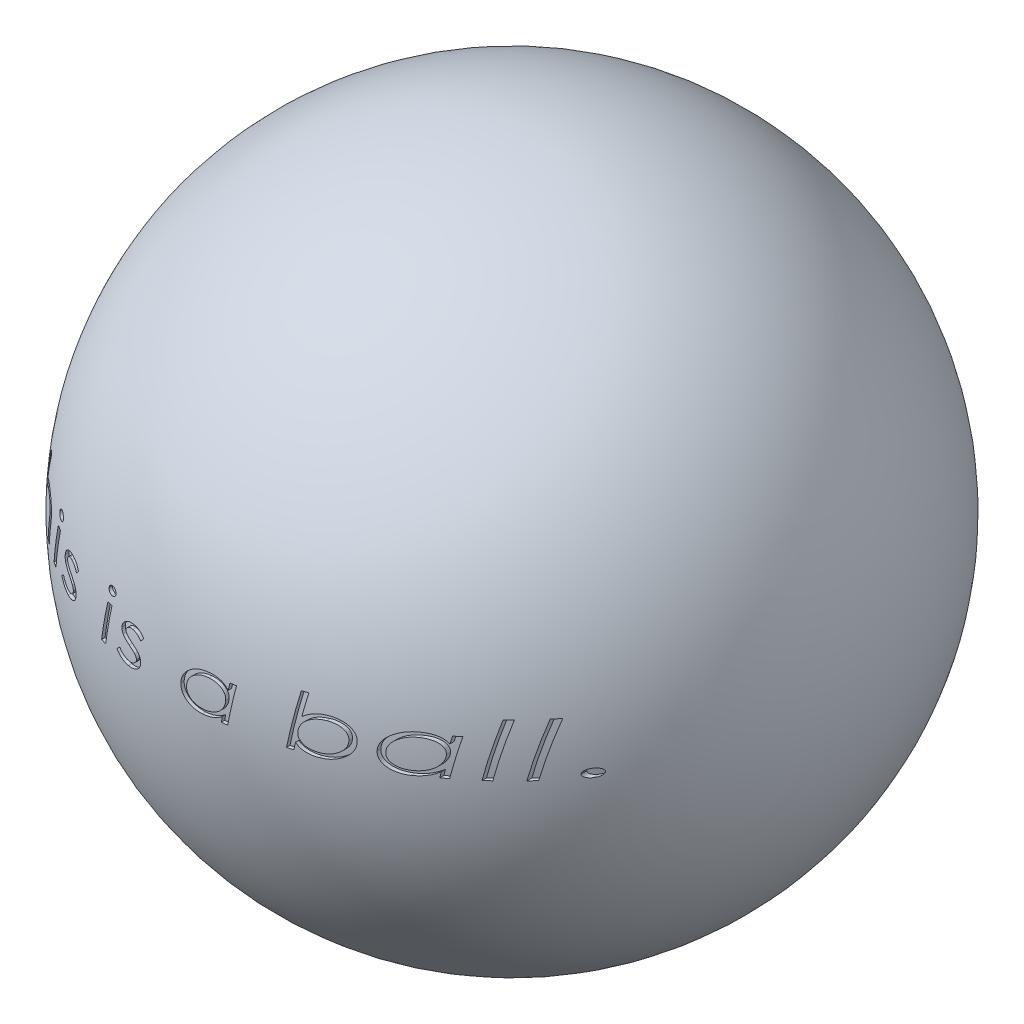
from build123d import *

# Parameters (mm, degrees)
CUT_EXTRUDE2_DEPTH = 40


with BuildPart() as part:
    # Sketch1 → Revolve1 (revolve)
    with BuildSketch(Plane.XY):
        with BuildLine():
            Line((0, 0), (100, 0))
            ThreePointArc((100, 0), (50, 50), (0, 0))
        make_face()
    revolve(axis=Axis((0, 0, 0), (1, 0, 0)))

    # Sketch2 → Cut-Extrude2 (cut)
    # profile 1 of 14: a face of its own
    with BuildSketch(Plane.XY.offset(50)):
        Polygon((6.972898638, 7.408333333), (12.549925214, 7.408333333), (12.428233841, 6.743482906), (10.156166867, 6.743482906), (9.044620059, 0), (8.085929487, 0), (9.197476295, 6.743482906), (6.851207265, 6.743482906), align=None)
    # profile 2 of 14: a face of its own
    with BuildSketch(Plane.XY.offset(50)):
        with BuildLine():
            Line((14.416255342, 7.598290598), (15.27848324, 7.598290598))
            Line((15.27848324, 7.598290598), (14.765005008, 4.496644631))
            add(Edge.make_bspline(
                [(14.765005008, 4.496644631), (14.860136595, 4.57749569), (15.04660089, 4.735969191), (15.344955149, 4.941255012), (15.648867908, 5.117681081), (15.961918837, 5.260965263), (16.283095614, 5.371588321), (16.611652305, 5.449760597), (16.948011631, 5.499325405), (17.174917112, 5.505597364), (17.289358974, 5.508760684)],
                knots=[0, 0, 0, 0, 1.076214626, 2.109452906, 3.118662003, 4.103837887, 5.073978004, 6.043639511, 7.01329163, 8, 8, 8, 8], degree=3))
            add(Edge.make_bspline(
                [(17.289358974, 5.508760684), (17.375496917, 5.507550728), (17.544159211, 5.505181576), (17.790983509, 5.480340389), (18.026328486, 5.44280498), (18.249001314, 5.387611265), (18.459869647, 5.318208737), (18.657676316, 5.231500091), (18.844492884, 5.13067143), (19.017042073, 5.013789796), (19.173925723, 4.885567275), (19.312401339, 4.747561803), (19.426771709, 4.597321891), (19.523407733, 4.440009452), (19.59611357, 4.271235652), (19.65020652, 4.094281378), (19.681757997, 3.907120157), (19.685610216, 3.77947496), (19.687569444, 3.714554955)],
                knots=[0, 0, 0, 0, 1.235015424, 2.418220465, 3.554284762, 4.650412109, 5.704900393, 6.734340054, 7.743931567, 8.745539027, 9.71846673, 10.64659281, 11.542036245, 12.420539361, 13.287884324, 14.169961337, 15.069247233, 16, 16, 16, 16], degree=3))
            add(Edge.make_bspline(
                [(19.687569444, 3.714554955), (19.687333752, 3.67645914), (19.686837613, 3.596266514), (19.680680862, 3.471035104), (19.669401188, 3.335088778), (19.657456686, 3.188875204), (19.63592404, 3.032474126), (19.617274414, 2.865286699), (19.588889748, 2.688045733), (19.569801091, 2.566404435), (19.559941907, 2.50357739)],
                knots=[0, 0, 0, 0, 0.750036975, 1.578846247, 2.467797257, 3.436025511, 4.466525469, 5.575551111, 6.747785821, 8, 8, 8, 8], degree=3))
            Line((19.559941907, 2.50357739), (19.141442308, 0))
            Line((19.141442308, 0), (18.27921441, 0))
            Line((18.27921441, 0), (18.697714009, 2.500609308))
            add(Edge.make_bspline(
                [(18.697714009, 2.500609308), (18.707993561, 2.561891792), (18.727937738, 2.680790815), (18.750552053, 2.854257126), (18.772101936, 3.016848585), (18.788915498, 3.168686556), (18.798542599, 3.310345129), (18.806597901, 3.440901498), (18.80995142, 3.561198059), (18.808314475, 3.637880328), (18.807533053, 3.674485844)],
                knots=[0, 0, 0, 0, 1.262966209, 2.450381239, 3.55540805, 4.596989276, 5.554828615, 6.441118602, 7.25584286, 8, 8, 8, 8], degree=3))
            add(Edge.make_bspline(
                [(18.807533053, 3.674485844), (18.806023477, 3.717107516), (18.803056172, 3.800887003), (18.782102351, 3.923683919), (18.746287963, 4.039730612), (18.696882231, 4.149692993), (18.632346537, 4.25290632), (18.552837668, 4.349353518), (18.460680355, 4.440354644), (18.354564474, 4.522991663), (18.237880225, 4.599018195), (18.109776151, 4.663243618), (17.974277192, 4.720356034), (17.829455354, 4.766905896), (17.675084009, 4.799709837), (17.512110187, 4.825022126), (17.340677655, 4.842246349), (17.223114632, 4.843348634), (17.163215478, 4.843910256)],
                knots=[0, 0, 0, 0, 0.907329905, 1.783497237, 2.643047196, 3.486836209, 4.34315355, 5.226508387, 6.14259909, 7.095024576, 8.085421458, 9.1028909, 10.141563833, 11.214128256, 12.335982046, 13.497910263, 14.725168395, 16, 16, 16, 16], degree=3))
            add(Edge.make_bspline(
                [(17.163215478, 4.843910256), (17.050241659, 4.840871843), (16.826677066, 4.834859107), (16.496073372, 4.783717145), (16.174646585, 4.702715758), (15.867227052, 4.588749796), (15.580351567, 4.450366565), (15.324539736, 4.28483684), (15.102125082, 4.097080471), (14.944144422, 3.918142817), (14.835776995, 3.755969871), (14.76098825, 3.61431117), (14.690040813, 3.453508705), (14.62327195, 3.273731412), (14.562914057, 3.07376448), (14.507134548, 2.854293137), (14.454677727, 2.615379571), (14.426425079, 2.448803288), (14.411803218, 2.362593483)],
                knots=[0, 0, 0, 0, 1.310456236, 2.593269982, 3.872881046, 5.151577425, 6.391686378, 7.562077559, 8.677948065, 9.760232801, 10.319112407, 10.938122858, 11.616622988, 12.357760014, 13.162249536, 14.039467798, 14.985347147, 16, 16, 16, 16], degree=3))
            Line((14.411803218, 2.362593483), (14.02001636, 0))
            Line((14.02001636, 0), (13.157788462, 0))
            Line((13.157788462, 0), (14.416255342, 7.598290598))
        make_face()
    # profile 3 of 14: a face of its own
    with BuildSketch(Plane.XY.offset(50)):
        with BuildLine():
            add(Edge.make_bspline(
                [(23.405982906, 7.693269231), (23.453144713, 7.691358901), (23.545098515, 7.687634234), (23.678121233, 7.655977364), (23.799510343, 7.601331642), (23.908654608, 7.529489925), (24.000474547, 7.44314744), (24.070029934, 7.345576554), (24.110379697, 7.236661137), (24.115664344, 7.161303929), (24.11832265, 7.123397436)],
                knots=[0, 0, 0, 0, 1.12083234, 2.185344453, 3.228309232, 4.272600601, 5.279636797, 6.209847376, 7.099510034, 8, 8, 8, 8], degree=3))
            add(Edge.make_bspline(
                [(24.11832265, 7.123397436), (24.115646807, 7.085010419), (24.110328726, 7.008718453), (24.070433206, 6.898599034), (24.000459214, 6.800634776), (23.908561207, 6.714575414), (23.80024214, 6.641776842), (23.677342607, 6.591637661), (23.545204397, 6.558915652), (23.453180609, 6.555352917), (23.405982906, 6.553525641)],
                knots=[0, 0, 0, 0, 0.91064925, 1.809862517, 2.73851646, 3.743867456, 4.786411282, 5.818312556, 6.881043288, 8, 8, 8, 8], degree=3))
            add(Edge.make_bspline(
                [(23.405982906, 6.553525641), (23.3577999, 6.555335297), (23.264311563, 6.558846529), (23.130594232, 6.591354419), (23.007288773, 6.641837207), (22.899206408, 6.714234474), (22.808115168, 6.80020616), (22.741960139, 6.899529551), (22.701481116, 7.008617479), (22.696266796, 7.08497662), (22.693643162, 7.123397436)],
                knots=[0, 0, 0, 0, 1.140503825, 2.212892386, 3.243091902, 4.28391642, 5.279146858, 6.193122213, 7.090852545, 8, 8, 8, 8], degree=3))
            add(Edge.make_bspline(
                [(22.693643162, 7.123397436), (22.696250184, 7.161337109), (22.70143288, 7.236760275), (22.742352308, 7.344652428), (22.808098768, 7.44357782), (22.899114402, 7.529828113), (23.008020149, 7.601271963), (23.129810806, 7.656272244), (23.264420349, 7.687696674), (23.357836899, 7.691373981), (23.405982906, 7.693269231)],
                knots=[0, 0, 0, 0, 0.89900244, 1.787195458, 2.702700314, 3.699596231, 4.742162527, 5.783404425, 6.857587587, 8, 8, 8, 8], degree=3))
        make_face()
    # profile 4 of 14: a face of its own
    with BuildSketch(Plane.XY.offset(50)):
        Polygon((22.747068643, 5.413782051), (23.610780582, 5.413782051), (22.701063368, 0), (21.83883547, 0), align=None)
    # profile 5 of 14: a face of its own
    with BuildSketch(Plane.XY.offset(50)):
        with BuildLine():
            Line((29.688819444, 4.75635183), (29.202053953, 4.187964076))
            add(Edge.make_bspline(
                [(29.202053953, 4.187964076), (29.149703697, 4.240593243), (29.047130645, 4.343712783), (28.877250834, 4.475975446), (28.701850995, 4.589032547), (28.51997341, 4.684525768), (28.32914951, 4.755238797), (28.131165247, 4.805807273), (27.926342182, 4.83812314), (27.786892831, 4.841969461), (27.716528779, 4.843910256)],
                knots=[0, 0, 0, 0, 1.065046905, 2.086811445, 3.083831041, 4.059181774, 5.030255031, 5.998518253, 6.990082334, 8, 8, 8, 8], degree=3))
            add(Edge.make_bspline(
                [(27.716528779, 4.843910256), (27.637701193, 4.840935225), (27.484345176, 4.835147415), (27.262974582, 4.793945849), (27.059672937, 4.722105577), (26.880510047, 4.623877008), (26.729124338, 4.511449508), (26.617889849, 4.387350221), (26.544366378, 4.254929754), (26.535238251, 4.161082628), (26.530779915, 4.11524606)],
                knots=[0, 0, 0, 0, 1.248232746, 2.428388461, 3.550988634, 4.648397772, 5.654460817, 6.520507429, 7.277390118, 8, 8, 8, 8], degree=3))
            add(Edge.make_bspline(
                [(26.530779915, 4.11524606), (26.533490096, 4.079764985), (26.538992554, 4.007728079), (26.581110702, 3.902446798), (26.647434772, 3.799898867), (26.708038949, 3.740155281), (26.740029714, 3.70861879)],
                knots=[0, 0, 0, 0, 0.903490396, 1.834348362, 2.856830367, 4, 4, 4, 4], degree=3))
            add(Edge.make_bspline(
                [(26.740029714, 3.70861879), (26.759611611, 3.691552637), (26.802394925, 3.654265822), (26.877317376, 3.598964307), (26.969741535, 3.542531903), (27.077117717, 3.479293839), (27.201770794, 3.413244671), (27.342545694, 3.342549457), (27.498683984, 3.265841675), (27.609500069, 3.216524941), (27.667555422, 3.190688435)],
                knots=[0, 0, 0, 0, 0.584763275, 1.277614275, 2.093492508, 3.02196788, 4.083436894, 5.269031656, 6.569275109, 8, 8, 8, 8], degree=3))
            add(Edge.make_bspline(
                [(27.667555422, 3.190688435), (27.752413394, 3.152169767), (27.915239298, 3.078259952), (28.145151503, 2.963056081), (28.354146863, 2.854272495), (28.538823201, 2.745984389), (28.701885709, 2.642403509), (28.841607199, 2.541385359), (28.960548711, 2.445009496), (29.026083663, 2.375627591), (29.056617922, 2.343300948)],
                knots=[0, 0, 0, 0, 1.366394551, 2.621844745, 3.770530423, 4.820569702, 5.760251889, 6.601830338, 7.348560241, 8, 8, 8, 8], degree=3))
            add(Edge.make_bspline(
                [(29.056617922, 2.343300948), (29.105996915, 2.280071087), (29.203277025, 2.15550379), (29.306857801, 1.942605486), (29.368001099, 1.713999845), (29.376047393, 1.556638368), (29.380138889, 1.476620927)],
                knots=[0, 0, 0, 0, 1.01675931, 2.003087742, 2.984581152, 4, 4, 4, 4], degree=3))
            add(Edge.make_bspline(
                [(29.380138889, 1.476620927), (29.378762055, 1.421065546), (29.376048988, 1.311593048), (29.344521927, 1.151782786), (29.297027176, 0.998699287), (29.230592246, 0.852115197), (29.140648028, 0.715281628), (29.035751551, 0.583527619), (28.908720519, 0.461744132), (28.766287831, 0.346660251), (28.607410281, 0.243279687), (28.436003255, 0.152564289), (28.253370805, 0.075276892), (28.058553494, 0.012956067), (27.852697561, -0.035996201), (27.635277259, -0.069297814), (27.406793026, -0.090746283), (27.250590348, -0.093542935), (27.170401643, -0.094978632)],
                knots=[0, 0, 0, 0, 0.882045941, 1.738081362, 2.578771594, 3.426822789, 4.286318992, 5.175522672, 6.098679517, 7.077535153, 8.083068511, 9.106796286, 10.156974707, 11.231343161, 12.354841379, 13.517164588, 14.725403694, 16, 16, 16, 16], degree=3))
            add(Edge.make_bspline(
                [(27.170401643, -0.094978632), (27.064376804, -0.092771993), (26.855375333, -0.088422154), (26.548936601, -0.043252793), (26.254839635, 0.025538381), (25.974265063, 0.12410471), (25.706735135, 0.251154646), (25.452741845, 0.406535968), (25.209177011, 0.587923073), (25.062104178, 0.729465264), (24.987377137, 0.801382212)],
                knots=[0, 0, 0, 0, 1.048294237, 2.066450101, 3.057676668, 4.032848047, 5.002674497, 5.98222065, 6.974775437, 8, 8, 8, 8], degree=3))
            Line((24.987377137, 0.801382212), (25.532020232, 1.305956197))
            add(Edge.make_bspline(
                [(25.532020232, 1.305956197), (25.598890575, 1.247468635), (25.730067066, 1.132736261), (25.938525204, 0.982579901), (26.151981632, 0.855276189), (26.369617258, 0.751468506), (26.591669114, 0.670141971), (26.817751494, 0.612055215), (27.04910007, 0.577020776), (27.20491094, 0.57226237), (27.283188769, 0.569871795)],
                knots=[0, 0, 0, 0, 1.095694798, 2.149374359, 3.164755529, 4.158534515, 5.120133565, 6.077947732, 7.034380094, 8, 8, 8, 8], degree=3))
            add(Edge.make_bspline(
                [(27.283188769, 0.569871795), (27.370494298, 0.573365955), (27.540690159, 0.58017757), (27.787341502, 0.63122335), (28.015767291, 0.718026485), (28.188741068, 0.818878078), (28.314189833, 0.911311654), (28.395435207, 0.985204521), (28.464837166, 1.061549323), (28.521546326, 1.13997163), (28.565888687, 1.221693969), (28.596469421, 1.306297308), (28.617408248, 1.393495116), (28.6193389, 1.452755094), (28.620309829, 1.482557091)],
                knots=[0, 0, 0, 0, 1.768851066, 3.448248125, 5.079541365, 6.701346398, 7.489471981, 8.234783124, 8.923442416, 9.577354201, 10.191953515, 10.801047985, 11.397043912, 12, 12, 12, 12], degree=3))
            add(Edge.make_bspline(
                [(28.620309829, 1.482557091), (28.616308885, 1.531546074), (28.60809172, 1.632159973), (28.547301141, 1.779052474), (28.449606795, 1.920830404), (28.363279763, 2.003957146), (28.317565438, 2.047976763)],
                knots=[0, 0, 0, 0, 0.889096953, 1.826033272, 2.848779816, 4, 4, 4, 4], degree=3))
            add(Edge.make_bspline(
                [(28.317565438, 2.047976763), (28.297994439, 2.063607774), (28.253324672, 2.099284729), (28.1722448, 2.151683417), (28.071573356, 2.212553707), (27.94925051, 2.279345931), (27.805043177, 2.351158753), (27.640696718, 2.431643886), (27.454709446, 2.517235236), (27.323789964, 2.576379863), (27.254991987, 2.60746027)],
                knots=[0, 0, 0, 0, 0.499217942, 1.139438444, 1.922738111, 2.845446788, 3.917485197, 5.135170685, 6.494536811, 8, 8, 8, 8], degree=3))
            add(Edge.make_bspline(
                [(27.254991987, 2.60746027), (27.180192048, 2.641858038), (27.036852802, 2.707774538), (26.832806501, 2.805991771), (26.651709277, 2.905019453), (26.490054481, 2.997935514), (26.347578719, 3.086161943), (26.228041605, 3.174070004), (26.126470225, 3.255978966), (26.071170614, 3.314768382), (26.045498464, 3.34206063)],
                knots=[0, 0, 0, 0, 1.388265562, 2.660335561, 3.817319581, 4.867440863, 5.804658646, 6.640521327, 7.368879085, 8, 8, 8, 8], degree=3))
            add(Edge.make_bspline(
                [(26.045498464, 3.34206063), (26.003304677, 3.393557331), (25.920615856, 3.494477436), (25.834802306, 3.66761666), (25.781279756, 3.850392029), (25.774428424, 3.975870269), (25.770950855, 4.039559963)],
                knots=[0, 0, 0, 0, 1.039747008, 2.037633, 3.003950378, 4, 4, 4, 4], degree=3))
            add(Edge.make_bspline(
                [(25.770950855, 4.039559963), (25.772483202, 4.089663571), (25.775512535, 4.188714612), (25.805110235, 4.333849156), (25.851665799, 4.473236312), (25.915085213, 4.607750737), (26.000387771, 4.734516246), (26.10147118, 4.857200741), (26.222841661, 4.972584585), (26.360381547, 5.081868797), (26.511843412, 5.181685202), (26.674547867, 5.26994753), (26.847500708, 5.344054522), (27.030031129, 5.405276886), (27.222566345, 5.450156844), (27.423570958, 5.485368739), (27.635057195, 5.503849104), (27.77932277, 5.507099384), (27.853060564, 5.508760684)],
                knots=[0, 0, 0, 0, 0.851110712, 1.682581483, 2.50721579, 3.34626884, 4.202518756, 5.098624722, 6.044554989, 7.044310791, 8.082538047, 9.125152126, 10.187732326, 11.2783777, 12.394420148, 13.546404715, 14.745905221, 16, 16, 16, 16], degree=3))
            add(Edge.make_bspline(
                [(27.853060564, 5.508760684), (27.939728304, 5.506869291), (28.109195603, 5.503170923), (28.357077631, 5.471183368), (28.592663621, 5.419528743), (28.818864959, 5.346166147), (29.040050417, 5.2464229), (29.258533421, 5.114246248), (29.477514132, 4.949820469), (29.616675035, 4.822406396), (29.688819444, 4.75635183)],
                knots=[0, 0, 0, 0, 1.019074265, 1.992664874, 2.934294439, 3.852476961, 4.784765789, 5.781654952, 6.849955774, 8, 8, 8, 8], degree=3))
        make_face()
    # profile 6 of 14: a face of its own
    with BuildSketch(Plane.XY.offset(50)):
        with BuildLine():
            add(Edge.make_bspline(
                [(37.196880342, 7.693269231), (37.244042149, 7.691358901), (37.33599595, 7.687634234), (37.469018669, 7.655977364), (37.590407779, 7.601331642), (37.699552043, 7.529489925), (37.791371983, 7.44314744), (37.86092737, 7.345576554), (37.901277133, 7.236661137), (37.90656178, 7.161303929), (37.909220085, 7.123397436)],
                knots=[0, 0, 0, 0, 1.12083234, 2.185344453, 3.228309232, 4.272600601, 5.279636797, 6.209847376, 7.099510034, 8, 8, 8, 8], degree=3))
            add(Edge.make_bspline(
                [(37.909220085, 7.123397436), (37.906544243, 7.085010419), (37.901226161, 7.008718453), (37.861330642, 6.898599034), (37.79135665, 6.800634776), (37.699458643, 6.714575414), (37.591139576, 6.641776842), (37.468240042, 6.591637661), (37.336101833, 6.558915652), (37.244078045, 6.555352917), (37.196880342, 6.553525641)],
                knots=[0, 0, 0, 0, 0.91064925, 1.809862517, 2.73851646, 3.743867456, 4.786411282, 5.818312556, 6.881043288, 8, 8, 8, 8], degree=3))
            add(Edge.make_bspline(
                [(37.196880342, 6.553525641), (37.148697336, 6.555335297), (37.055208999, 6.558846529), (36.921491668, 6.591354419), (36.798186209, 6.641837207), (36.690103844, 6.714234474), (36.599012604, 6.80020616), (36.532857575, 6.899529551), (36.492378552, 7.008617479), (36.487164232, 7.08497662), (36.484540598, 7.123397436)],
                knots=[0, 0, 0, 0, 1.140503825, 2.212892386, 3.243091902, 4.28391642, 5.279146858, 6.193122213, 7.090852545, 8, 8, 8, 8], degree=3))
            add(Edge.make_bspline(
                [(36.484540598, 7.123397436), (36.48714762, 7.161337109), (36.492330316, 7.236760275), (36.533249744, 7.344652428), (36.598996204, 7.44357782), (36.690011838, 7.529828113), (36.798917585, 7.601271963), (36.920708242, 7.656272244), (37.055317785, 7.687696674), (37.148734335, 7.691373981), (37.196880342, 7.693269231)],
                knots=[0, 0, 0, 0, 0.89900244, 1.787195458, 2.702700314, 3.699596231, 4.742162527, 5.783404425, 6.857587587, 8, 8, 8, 8], degree=3))
        make_face()
    # profile 7 of 14: a face of its own
    with BuildSketch(Plane.XY.offset(50)):
        Polygon((36.537966079, 5.413782051), (37.401678018, 5.413782051), (36.491960804, 0), (35.629732906, 0), align=None)
    # profile 8 of 14: a face of its own
    with BuildSketch(Plane.XY.offset(50)):
        with BuildLine():
            Line((43.47971688, 4.75635183), (42.992951389, 4.187964076))
            add(Edge.make_bspline(
                [(42.992951389, 4.187964076), (42.940601133, 4.240593243), (42.83802808, 4.343712783), (42.668148269, 4.475975446), (42.492748431, 4.589032547), (42.310870845, 4.684525768), (42.120046946, 4.755238797), (41.922062683, 4.805807273), (41.717239618, 4.83812314), (41.577790266, 4.841969461), (41.507426215, 4.843910256)],
                knots=[0, 0, 0, 0, 1.065046905, 2.086811445, 3.083831041, 4.059181774, 5.030255031, 5.998518253, 6.990082334, 8, 8, 8, 8], degree=3))
            add(Edge.make_bspline(
                [(41.507426215, 4.843910256), (41.428598629, 4.840935225), (41.275242612, 4.835147415), (41.053872018, 4.793945849), (40.850570373, 4.722105577), (40.671407483, 4.623877008), (40.520021774, 4.511449508), (40.408787285, 4.387350221), (40.335263814, 4.254929754), (40.326135686, 4.161082628), (40.32167735, 4.11524606)],
                knots=[0, 0, 0, 0, 1.248232746, 2.428388461, 3.550988634, 4.648397772, 5.654460817, 6.520507429, 7.277390118, 8, 8, 8, 8], degree=3))
            add(Edge.make_bspline(
                [(40.32167735, 4.11524606), (40.324387532, 4.079764985), (40.32988999, 4.007728079), (40.372008138, 3.902446798), (40.438332208, 3.799898867), (40.498936384, 3.740155281), (40.53092715, 3.70861879)],
                knots=[0, 0, 0, 0, 0.903490396, 1.834348362, 2.856830367, 4, 4, 4, 4], degree=3))
            add(Edge.make_bspline(
                [(40.53092715, 3.70861879), (40.550509047, 3.691552637), (40.593292361, 3.654265822), (40.668214812, 3.598964307), (40.760638971, 3.542531903), (40.868015153, 3.479293839), (40.99266823, 3.413244671), (41.13344313, 3.342549457), (41.28958142, 3.265841675), (41.400397505, 3.216524941), (41.458452858, 3.190688435)],
                knots=[0, 0, 0, 0, 0.584763275, 1.277614275, 2.093492508, 3.02196788, 4.083436894, 5.269031656, 6.569275109, 8, 8, 8, 8], degree=3))
            add(Edge.make_bspline(
                [(41.458452858, 3.190688435), (41.54331083, 3.152169767), (41.706136733, 3.078259952), (41.936048939, 2.963056081), (42.145044299, 2.854272495), (42.329720637, 2.745984389), (42.492783145, 2.642403509), (42.632504635, 2.541385359), (42.751446146, 2.445009496), (42.816981099, 2.375627591), (42.847515358, 2.343300948)],
                knots=[0, 0, 0, 0, 1.366394551, 2.621844745, 3.770530423, 4.820569702, 5.760251889, 6.601830338, 7.348560241, 8, 8, 8, 8], degree=3))
            add(Edge.make_bspline(
                [(42.847515358, 2.343300948), (42.896894351, 2.280071087), (42.99417446, 2.15550379), (43.097755237, 1.942605486), (43.158898535, 1.713999845), (43.166944829, 1.556638368), (43.171036325, 1.476620927)],
                knots=[0, 0, 0, 0, 1.01675931, 2.003087742, 2.984581152, 4, 4, 4, 4], degree=3))
            add(Edge.make_bspline(
                [(43.171036325, 1.476620927), (43.169659491, 1.421065546), (43.166946424, 1.311593048), (43.135419363, 1.151782786), (43.087924612, 0.998699287), (43.021489682, 0.852115197), (42.931545464, 0.715281628), (42.826648987, 0.583527619), (42.699617955, 0.461744132), (42.557185267, 0.346660251), (42.398307717, 0.243279687), (42.22690069, 0.152564289), (42.044268241, 0.075276892), (41.84945093, 0.012956067), (41.643594997, -0.035996201), (41.426174695, -0.069297814), (41.197690462, -0.090746283), (41.041487784, -0.093542935), (40.961299079, -0.094978632)],
                knots=[0, 0, 0, 0, 0.882045941, 1.738081362, 2.578771594, 3.426822789, 4.286318992, 5.175522672, 6.098679517, 7.077535153, 8.083068511, 9.106796286, 10.156974707, 11.231343161, 12.354841379, 13.517164588, 14.725403694, 16, 16, 16, 16], degree=3))
            add(Edge.make_bspline(
                [(40.961299079, -0.094978632), (40.85527424, -0.092771993), (40.646272769, -0.088422154), (40.339834037, -0.043252793), (40.045737071, 0.025538381), (39.765162499, 0.12410471), (39.497632571, 0.251154646), (39.243639281, 0.406535968), (39.000074447, 0.587923073), (38.853001614, 0.729465264), (38.778274573, 0.801382212)],
                knots=[0, 0, 0, 0, 1.048294237, 2.066450101, 3.057676668, 4.032848047, 5.002674497, 5.98222065, 6.974775437, 8, 8, 8, 8], degree=3))
            Line((38.778274573, 0.801382212), (39.322917668, 1.305956197))
            add(Edge.make_bspline(
                [(39.322917668, 1.305956197), (39.389788011, 1.247468635), (39.520964502, 1.132736261), (39.72942264, 0.982579901), (39.942879068, 0.855276189), (40.160514694, 0.751468506), (40.38256655, 0.670141971), (40.60864893, 0.612055215), (40.839997506, 0.577020776), (40.995808376, 0.57226237), (41.074086205, 0.569871795)],
                knots=[0, 0, 0, 0, 1.095694798, 2.149374359, 3.164755529, 4.158534515, 5.120133565, 6.077947732, 7.034380094, 8, 8, 8, 8], degree=3))
            add(Edge.make_bspline(
                [(41.074086205, 0.569871795), (41.161391734, 0.573365955), (41.331587595, 0.58017757), (41.578238938, 0.63122335), (41.806664727, 0.718026485), (41.979638504, 0.818878078), (42.105087269, 0.911311654), (42.186332643, 0.985204521), (42.255734602, 1.061549323), (42.312443762, 1.13997163), (42.356786123, 1.221693969), (42.387366856, 1.306297308), (42.408305684, 1.393495116), (42.410236335, 1.452755094), (42.411207265, 1.482557091)],
                knots=[0, 0, 0, 0, 1.768851066, 3.448248125, 5.079541365, 6.701346398, 7.489471981, 8.234783124, 8.923442416, 9.577354201, 10.191953515, 10.801047985, 11.397043912, 12, 12, 12, 12], degree=3))
            add(Edge.make_bspline(
                [(42.411207265, 1.482557091), (42.407206321, 1.531546074), (42.398989156, 1.632159973), (42.338198577, 1.779052474), (42.240504231, 1.920830404), (42.154177199, 2.003957146), (42.108462874, 2.047976763)],
                knots=[0, 0, 0, 0, 0.889096953, 1.826033272, 2.848779816, 4, 4, 4, 4], degree=3))
            add(Edge.make_bspline(
                [(42.108462874, 2.047976763), (42.088891875, 2.063607774), (42.044222108, 2.099284729), (41.963142236, 2.151683417), (41.862470792, 2.212553707), (41.740147946, 2.279345931), (41.595940613, 2.351158753), (41.431594154, 2.431643886), (41.245606882, 2.517235236), (41.1146874, 2.576379863), (41.045889423, 2.60746027)],
                knots=[0, 0, 0, 0, 0.499217942, 1.139438444, 1.922738111, 2.845446788, 3.917485197, 5.135170685, 6.494536811, 8, 8, 8, 8], degree=3))
            add(Edge.make_bspline(
                [(41.045889423, 2.60746027), (40.971089484, 2.641858038), (40.827750238, 2.707774538), (40.623703936, 2.805991771), (40.442606713, 2.905019453), (40.280951917, 2.997935514), (40.138476155, 3.086161943), (40.018939041, 3.174070004), (39.917367661, 3.255978966), (39.86206805, 3.314768382), (39.8363959, 3.34206063)],
                knots=[0, 0, 0, 0, 1.388265562, 2.660335561, 3.817319581, 4.867440863, 5.804658646, 6.640521327, 7.368879085, 8, 8, 8, 8], degree=3))
            add(Edge.make_bspline(
                [(39.8363959, 3.34206063), (39.794202112, 3.393557331), (39.711513292, 3.494477436), (39.625699742, 3.66761666), (39.572177192, 3.850392029), (39.56532586, 3.975870269), (39.561848291, 4.039559963)],
                knots=[0, 0, 0, 0, 1.039747008, 2.037633, 3.003950378, 4, 4, 4, 4], degree=3))
            add(Edge.make_bspline(
                [(39.561848291, 4.039559963), (39.563380637, 4.089663571), (39.566409971, 4.188714612), (39.59600767, 4.333849156), (39.642563235, 4.473236312), (39.705982648, 4.607750737), (39.791285207, 4.734516246), (39.892368616, 4.857200741), (40.013739097, 4.972584585), (40.151278983, 5.081868797), (40.302740848, 5.181685202), (40.465445303, 5.26994753), (40.638398144, 5.344054522), (40.820928565, 5.405276886), (41.013463781, 5.450156844), (41.214468394, 5.485368739), (41.425954631, 5.503849104), (41.570220206, 5.507099384), (41.643957999, 5.508760684)],
                knots=[0, 0, 0, 0, 0.851110712, 1.682581483, 2.50721579, 3.34626884, 4.202518756, 5.098624722, 6.044554989, 7.044310791, 8.082538047, 9.125152126, 10.187732326, 11.2783777, 12.394420148, 13.546404715, 14.745905221, 16, 16, 16, 16], degree=3))
            add(Edge.make_bspline(
                [(41.643957999, 5.508760684), (41.73062574, 5.506869291), (41.900093038, 5.503170923), (42.147975067, 5.471183368), (42.383561057, 5.419528743), (42.609762395, 5.346166147), (42.830947853, 5.2464229), (43.049430857, 5.114246248), (43.268411568, 4.949820469), (43.407572471, 4.822406396), (43.47971688, 4.75635183)],
                knots=[0, 0, 0, 0, 1.019074265, 1.992664874, 2.934294439, 3.852476961, 4.784765789, 5.781654952, 6.849955774, 8, 8, 8, 8], degree=3))
        make_face()
    # profile 9 of 14: a face of its own
    with BuildSketch(Plane.XY.offset(50)):
        with BuildLine():
            Line((56.449049145, 0), (55.586821247, 0))
            Line((55.586821247, 0), (55.723353032, 0.811770499))
            add(Edge.make_bspline(
                [(55.723353032, 0.811770499), (55.622595508, 0.739300437), (55.422809707, 0.595604077), (55.104535229, 0.411658253), (54.775648389, 0.254918864), (54.434930972, 0.127247547), (54.083049552, 0.027357826), (53.719806025, -0.044054345), (53.344429159, -0.085904489), (53.090273249, -0.091927962), (52.961552484, -0.094978632)],
                knots=[0, 0, 0, 0, 1.005956846, 1.994648997, 2.976161732, 3.957436708, 4.941560997, 5.939124516, 6.956241194, 8, 8, 8, 8], degree=3))
            add(Edge.make_bspline(
                [(52.961552484, -0.094978632), (52.845690978, -0.093398228), (52.618386042, -0.090297684), (52.285974226, -0.053780643), (51.967882663, -0.002577453), (51.666575332, 0.075757023), (51.379619153, 0.172425106), (51.111084371, 0.295683362), (50.855976606, 0.436414517), (50.620882524, 0.600765949), (50.405450721, 0.779773069), (50.218969522, 0.975544965), (50.059772642, 1.183002835), (49.929690404, 1.403581191), (49.829660121, 1.637196527), (49.758192606, 1.882803818), (49.713976411, 2.141366012), (49.708405249, 2.318389364), (49.705566239, 2.408598758)],
                knots=[0, 0, 0, 0, 1.211617855, 2.37703383, 3.495058042, 4.579614406, 5.630389009, 6.658811687, 7.666713829, 8.674562817, 9.655310361, 10.592440252, 11.49715346, 12.38567456, 13.264373761, 14.148770229, 15.056631148, 16, 16, 16, 16], degree=3))
            add(Edge.make_bspline(
                [(49.705566239, 2.408598758), (49.709442377, 2.513206899), (49.717101954, 2.719921432), (49.773127658, 3.024013432), (49.867740277, 3.315985865), (49.999873495, 3.596799587), (50.168112056, 3.867218076), (50.377576697, 4.122733516), (50.621063997, 4.369177731), (50.898982978, 4.600390055), (51.202360224, 4.811011378), (51.520053952, 5.000857861), (51.854511446, 5.155034923), (52.199902527, 5.286553069), (52.560198011, 5.384166848), (52.932273195, 5.458562173), (53.31828516, 5.499555743), (53.579813999, 5.505662809), (53.712477297, 5.508760684)],
                knots=[0, 0, 0, 0, 0.896607111, 1.771771485, 2.640913258, 3.521303397, 4.426297662, 5.364234586, 6.347937416, 7.39274828, 8.45875346, 9.512026621, 10.561270056, 11.612158048, 12.677158713, 13.75765355, 14.862545802, 16, 16, 16, 16], degree=3))
            add(Edge.make_bspline(
                [(53.712477297, 5.508760684), (53.854091958, 5.505763763), (54.129311916, 5.499939419), (54.528562752, 5.451034271), (54.900703172, 5.367578801), (55.192321865, 5.271547493), (55.409384923, 5.175420252), (55.564578568, 5.096902676), (55.710069608, 5.005590655), (55.850966045, 4.90860086), (55.980868105, 4.799076842), (56.105824364, 4.682723371), (56.222270192, 4.556047828), (56.293329675, 4.464983898), (56.328841814, 4.419474493)],
                knots=[0, 0, 0, 0, 1.731144421, 3.364379746, 4.908069982, 6.388502758, 7.108881604, 7.809513936, 8.512856251, 9.207563135, 9.899129577, 10.588045924, 11.294372751, 12, 12, 12, 12], degree=3))
            Line((56.328841814, 4.419474493), (56.498022503, 5.413782051))
            Line((56.498022503, 5.413782051), (57.35876636, 5.413782051))
            Line((57.35876636, 5.413782051), (56.449049145, 0))
        make_face()
        with BuildLine():
            add(Edge.make_bspline(
                [(53.006073718, 0.569871795), (53.076837748, 0.570616), (53.217042478, 0.572090493), (53.424623884, 0.587204764), (53.627095071, 0.612720533), (53.82469201, 0.646851051), (54.018086938, 0.689539594), (54.206876019, 0.743069028), (54.390550186, 0.806900046), (54.568839256, 0.879799452), (54.740472705, 0.960265531), (54.903025252, 1.051935162), (55.057486064, 1.150419845), (55.201460517, 1.259626095), (55.337278865, 1.375522707), (55.463911771, 1.499965235), (55.579189407, 1.634830614), (55.687841605, 1.774411473), (55.783974014, 1.921646907), (55.868772472, 2.072643467), (55.940419243, 2.227410471), (55.998096563, 2.385477471), (56.044766554, 2.545950752), (56.077192781, 2.709792707), (56.097318509, 2.877046931), (56.099299106, 2.989790962), (56.100299479, 3.046736445)],
                knots=[0, 0, 0, 0, 1.154537815, 2.287485061, 3.393808656, 4.483307877, 5.55844937, 6.623972713, 7.683363496, 8.729634383, 9.765893477, 10.774139951, 11.772743814, 12.752675614, 13.720127532, 14.684746694, 15.64608431, 16.613165745, 17.569134047, 18.512305441, 19.436883307, 20.348580994, 21.255549629, 22.161044364, 23.071168431, 24, 24, 24, 24], degree=3))
            add(Edge.make_bspline(
                [(56.100299479, 3.046736445), (56.098565102, 3.111703387), (56.095152743, 3.239524814), (56.060382815, 3.425957457), (56.009751775, 3.604083352), (55.934227923, 3.772101082), (55.836785746, 3.930149512), (55.718491692, 4.079301139), (55.579806187, 4.219332594), (55.420535304, 4.347834094), (55.245239922, 4.464265401), (55.05522124, 4.565678819), (54.852899587, 4.651382942), (54.637828886, 4.723496116), (54.409731871, 4.777573945), (54.169101344, 4.815675954), (53.916305849, 4.840332854), (53.74320714, 4.842699034), (53.654599693, 4.843910256)],
                knots=[0, 0, 0, 0, 0.918777795, 1.807680742, 2.676406941, 3.53542386, 4.406264815, 5.298802246, 6.224891562, 7.190725533, 8.191085784, 9.200014536, 10.235502688, 11.298571293, 12.407815344, 13.550000159, 14.74587031, 16, 16, 16, 16], degree=3))
            add(Edge.make_bspline(
                [(53.654599693, 4.843910256), (53.55013428, 4.842081438), (53.344139366, 4.8384752), (53.040961712, 4.804948624), (52.749020184, 4.75060004), (52.469293698, 4.672837715), (52.200775578, 4.575195611), (51.944266349, 4.45399448), (51.698711973, 4.311406252), (51.468141234, 4.14804871), (51.256564497, 3.969842446), (51.070198819, 3.780278502), (50.912016701, 3.57971568), (50.784002251, 3.368110383), (50.683625913, 3.146975654), (50.61119615, 2.915954377), (50.569512803, 2.674266552), (50.563443908, 2.509669413), (50.560373932, 2.426407252)],
                knots=[0, 0, 0, 0, 1.150975666, 2.269604147, 3.357042148, 4.420476637, 5.465699609, 6.502198733, 7.542933271, 8.591194565, 9.612455004, 10.587850796, 11.51596519, 12.421039903, 13.306745122, 14.18616944, 15.082466103, 16, 16, 16, 16], degree=3))
            add(Edge.make_bspline(
                [(50.560373932, 2.426407252), (50.562072506, 2.35847071), (50.565403653, 2.225237418), (50.600434736, 2.031016087), (50.65041798, 1.845055782), (50.728140941, 1.671204088), (50.823052382, 1.505809258), (50.941731583, 1.352501653), (51.081218665, 1.209404584), (51.23955048, 1.076344571), (51.414952013, 0.956727425), (51.605849444, 0.854632861), (51.80737956, 0.764142731), (52.023839436, 0.694535473), (52.251078774, 0.636719183), (52.491727428, 0.600307678), (52.744252337, 0.572860286), (52.917443448, 0.570883442), (53.006073718, 0.569871795)],
                knots=[0, 0, 0, 0, 0.947458558, 1.858101964, 2.748000752, 3.629524533, 4.508501257, 5.405049045, 6.328204841, 7.29389046, 8.288126096, 9.286383893, 10.313052591, 11.367977513, 12.456814588, 13.583207263, 14.763210229, 16, 16, 16, 16], degree=3))
        make_face(mode=Mode.SUBTRACT)
    # profile 10 of 14: a face of its own
    with BuildSketch(Plane.XY.offset(50)):
        with BuildLine():
            Line((65.098337674, 7.598290598), (65.960565572, 7.598290598))
            Line((65.960565572, 7.598290598), (65.450055422, 4.524841413))
            add(Edge.make_bspline(
                [(65.450055422, 4.524841413), (65.554732474, 4.603222014), (65.761662762, 4.758168299), (66.089862565, 4.958751959), (66.427682666, 5.129122541), (66.77620027, 5.266896383), (67.133771393, 5.376489579), (67.501826201, 5.453169953), (67.879658891, 5.500724381), (68.135040712, 5.506067052), (68.263797409, 5.508760684)],
                knots=[0, 0, 0, 0, 1.032414373, 2.040923007, 3.03341044, 4.017246561, 4.99738275, 5.983605547, 6.983387737, 8, 8, 8, 8], degree=3))
            add(Edge.make_bspline(
                [(68.263797409, 5.508760684), (68.380624587, 5.506980842), (68.609315578, 5.503496775), (68.944557279, 5.469889997), (69.263785053, 5.416139), (69.566669913, 5.337992409), (69.853828736, 5.24122667), (70.12424406, 5.119789586), (70.379054115, 4.977449967), (70.614868705, 4.813074193), (70.83038056, 4.634068289), (71.016615761, 4.437744993), (71.177620079, 4.231286807), (71.307446947, 4.010135915), (71.40758487, 3.776602947), (71.479023355, 3.530973442), (71.523247466, 3.272417305), (71.528817531, 3.095393115), (71.531655983, 3.005183293)],
                knots=[0, 0, 0, 0, 1.218991742, 2.386195011, 3.51254642, 4.594464447, 5.64756676, 6.671367886, 7.683845675, 8.689242928, 9.667604664, 10.602454854, 11.508107273, 12.394466919, 13.27102856, 14.153273608, 15.058926027, 16, 16, 16, 16], degree=3))
            add(Edge.make_bspline(
                [(71.531655983, 3.005183293), (71.52777885, 2.900575972), (71.520117309, 2.693863059), (71.46410604, 2.389759159), (71.369438975, 2.09783161), (71.237513434, 1.816846682), (71.068426329, 1.547029797), (70.861876589, 1.28855911), (70.616069853, 1.044202182), (70.339843192, 0.811939326), (70.038087927, 0.600483889), (69.719197856, 0.413781661), (69.386541023, 0.256171467), (69.039988728, 0.128693565), (68.68158473, 0.026738997), (68.309134026, -0.044028241), (67.923434429, -0.085972601), (67.661875573, -0.0919477), (67.529197049, -0.094978632)],
                knots=[0, 0, 0, 0, 0.897092525, 1.772730705, 2.642343023, 3.523209796, 4.428694016, 5.367790933, 6.355013256, 7.397137559, 8.460244584, 9.511941262, 10.563560885, 11.613535316, 12.676167944, 13.756439566, 14.861929996, 16, 16, 16, 16], degree=3))
            add(Edge.make_bspline(
                [(67.529197049, -0.094978632), (67.387053962, -0.091685605), (67.111167681, -0.085294149), (66.710609695, -0.032276063), (66.336518314, 0.052940498), (66.043265569, 0.153550984), (65.823998366, 0.253147516), (65.667931375, 0.336507902), (65.517872055, 0.428552736), (65.376723543, 0.533362506), (65.238782136, 0.64388999), (65.110290061, 0.766826625), (64.985782059, 0.896751624), (64.910636755, 0.991217743), (64.872763421, 1.038828793)],
                knots=[0, 0, 0, 0, 1.706223656, 3.311618663, 4.841805, 6.307032501, 7.024746138, 7.731587137, 8.430471889, 9.136188915, 9.841230697, 10.55135842, 11.269882714, 12, 12, 12, 12], degree=3))
            Line((64.872763421, 1.038828793), (64.70061465, 0))
            Line((64.70061465, 0), (63.838386752, 0))
            Line((63.838386752, 0), (65.098337674, 7.598290598))
        make_face()
        with BuildLine():
            add(Edge.make_bspline(
                [(68.214824052, 4.843910256), (68.074611901, 4.840384565), (67.798892645, 4.833451492), (67.39534092, 4.773427398), (67.008762153, 4.679580544), (66.703138914, 4.565650112), (66.470126778, 4.459460369), (66.305994426, 4.36937354), (66.150606517, 4.272123707), (66.004296416, 4.166105023), (65.867238878, 4.052236489), (65.741428227, 3.927644588), (65.621594984, 3.797882575), (65.514342393, 3.657948436), (65.415876993, 3.514224333), (65.333588429, 3.36403007), (65.259197215, 3.213608589), (65.202384609, 3.057906821), (65.154459129, 2.900293661), (65.125619727, 2.738273854), (65.102130945, 2.574001325), (65.100596445, 2.463103978), (65.099821715, 2.407114717)],
                knots=[0, 0, 0, 0, 1.911302771, 3.758468683, 5.551847929, 7.327756501, 8.197126728, 9.042473987, 9.879189092, 10.695639877, 11.50503575, 12.306548397, 13.108912419, 13.911871866, 14.708999807, 15.482244402, 16.245684759, 16.995044066, 17.740139385, 18.489042996, 19.23715608, 20, 20, 20, 20], degree=3))
            add(Edge.make_bspline(
                [(65.099821715, 2.407114717), (65.101605712, 2.340679916), (65.105116459, 2.20994217), (65.139134002, 2.019236366), (65.192184418, 1.837471908), (65.269027664, 1.665897569), (65.365740629, 1.503204216), (65.484628526, 1.350507111), (65.624802992, 1.207319476), (65.786927173, 1.077021972), (65.96345412, 0.956094399), (66.156953658, 0.855060176), (66.359781613, 0.764393732), (66.577070023, 0.694269532), (66.805392442, 0.636754634), (67.047018764, 0.60041486), (67.300023206, 0.572845691), (67.47321522, 0.570878501), (67.561845954, 0.569871795)],
                knots=[0, 0, 0, 0, 0.928162746, 1.82654128, 2.699775722, 3.569963844, 4.447816076, 5.340236436, 6.269609824, 7.242989106, 8.244449018, 9.256388988, 10.290937487, 11.3474524, 12.444645048, 13.579564652, 14.761346129, 16, 16, 16, 16], degree=3))
            add(Edge.make_bspline(
                [(67.561845954, 0.569871795), (67.667302342, 0.571665717), (67.87429003, 0.575186791), (68.178934796, 0.608925249), (68.472290737, 0.663414184), (68.754141317, 0.740654113), (69.024528602, 0.838629892), (69.28258928, 0.95969415), (69.529162109, 1.102476795), (69.76210747, 1.264620697), (69.975979822, 1.441562869), (70.163001099, 1.632607522), (70.32169696, 1.833865163), (70.451950431, 2.045229671), (70.552153899, 2.266838619), (70.624085538, 2.497983877), (70.668199354, 2.739345617), (70.6739439, 2.904084375), (70.676848291, 2.9873748)],
                knots=[0, 0, 0, 0, 1.157341405, 2.271606524, 3.360139637, 4.429898112, 5.476144378, 6.513516134, 7.554888654, 8.600387677, 9.625979832, 10.597570961, 11.52968968, 12.434059193, 13.316309599, 14.192303603, 15.086045069, 16, 16, 16, 16], degree=3))
            add(Edge.make_bspline(
                [(70.676848291, 2.9873748), (70.675091817, 3.055292763), (70.67164712, 3.188489619), (70.637412453, 3.383108632), (70.584412149, 3.568039409), (70.509971709, 3.742711579), (70.413616894, 3.90673186), (70.294996546, 4.05973934), (70.156931324, 4.204977054), (69.995714108, 4.335344162), (69.820189953, 4.455718164), (69.629177192, 4.559935109), (69.424969275, 4.646735364), (69.208726316, 4.720990776), (68.978197139, 4.77429543), (68.735327926, 4.814240788), (68.479564841, 4.840707933), (68.304428721, 4.842826392), (68.214824052, 4.843910256)],
                knots=[0, 0, 0, 0, 0.943432254, 1.850205807, 2.73821577, 3.613268048, 4.482571903, 5.375309737, 6.299494517, 7.261961358, 8.251971907, 9.255317652, 10.281179776, 11.333803266, 12.429750249, 13.56604082, 14.754716582, 16, 16, 16, 16], degree=3))
        make_face(mode=Mode.SUBTRACT)
    # profile 11 of 14: a face of its own
    with BuildSketch(Plane.XY.offset(50)):
        with BuildLine():
            Line((80.307681624, 0), (79.445453726, 0))
            Line((79.445453726, 0), (79.58198551, 0.811770499))
            add(Edge.make_bspline(
                [(79.58198551, 0.811770499), (79.481227986, 0.739300437), (79.281442186, 0.595604077), (78.963167708, 0.411658253), (78.634280868, 0.254918864), (78.293563451, 0.127247547), (77.94168203, 0.027357826), (77.578438504, -0.044054345), (77.203061638, -0.085904489), (76.948905728, -0.091927962), (76.820184963, -0.094978632)],
                knots=[0, 0, 0, 0, 1.005956846, 1.994648997, 2.976161732, 3.957436708, 4.941560997, 5.939124516, 6.956241194, 8, 8, 8, 8], degree=3))
            add(Edge.make_bspline(
                [(76.820184963, -0.094978632), (76.704323457, -0.093398228), (76.47701852, -0.090297684), (76.144606705, -0.053780643), (75.826515142, -0.002577453), (75.525207811, 0.075757023), (75.238251631, 0.172425106), (74.96971685, 0.295683362), (74.714609085, 0.436414517), (74.479515003, 0.600765949), (74.2640832, 0.779773069), (74.077602001, 0.975544965), (73.91840512, 1.183002835), (73.788322882, 1.403581191), (73.6882926, 1.637196527), (73.616825085, 1.882803818), (73.572608889, 2.141366012), (73.567037728, 2.318389364), (73.564198718, 2.408598758)],
                knots=[0, 0, 0, 0, 1.211617855, 2.37703383, 3.495058042, 4.579614406, 5.630389009, 6.658811687, 7.666713829, 8.674562817, 9.655310361, 10.592440252, 11.49715346, 12.38567456, 13.264373761, 14.148770229, 15.056631148, 16, 16, 16, 16], degree=3))
            add(Edge.make_bspline(
                [(73.564198718, 2.408598758), (73.568074856, 2.513206899), (73.575734433, 2.719921432), (73.631760137, 3.024013432), (73.726372756, 3.315985865), (73.858505974, 3.596799587), (74.026744534, 3.867218076), (74.236209176, 4.122733516), (74.479696476, 4.369177731), (74.757615457, 4.600390055), (75.060992702, 4.811011378), (75.378686431, 5.000857861), (75.713143924, 5.155034923), (76.058535006, 5.286553069), (76.41883049, 5.384166848), (76.790905673, 5.458562173), (77.176917639, 5.499555743), (77.438446477, 5.505662809), (77.571109776, 5.508760684)],
                knots=[0, 0, 0, 0, 0.896607111, 1.771771485, 2.640913258, 3.521303397, 4.426297662, 5.364234586, 6.347937416, 7.39274828, 8.45875346, 9.512026621, 10.561270056, 11.612158048, 12.677158713, 13.75765355, 14.862545802, 16, 16, 16, 16], degree=3))
            add(Edge.make_bspline(
                [(77.571109776, 5.508760684), (77.712724436, 5.505763763), (77.987944395, 5.499939419), (78.387195231, 5.451034271), (78.75933565, 5.367578801), (79.050954344, 5.271547493), (79.268017402, 5.175420252), (79.423211046, 5.096902676), (79.568702087, 5.005590655), (79.709598524, 4.90860086), (79.839500584, 4.799076842), (79.964456843, 4.682723371), (80.08090267, 4.556047828), (80.151962154, 4.464983898), (80.187474292, 4.419474493)],
                knots=[0, 0, 0, 0, 1.731144421, 3.364379746, 4.908069982, 6.388502758, 7.108881604, 7.809513936, 8.512856251, 9.207563135, 9.899129577, 10.588045924, 11.294372751, 12, 12, 12, 12], degree=3))
            Line((80.187474292, 4.419474493), (80.356654981, 5.413782051))
            Line((80.356654981, 5.413782051), (81.217398838, 5.413782051))
            Line((81.217398838, 5.413782051), (80.307681624, 0))
        make_face()
        with BuildLine():
            add(Edge.make_bspline(
                [(76.864706197, 0.569871795), (76.935470227, 0.570616), (77.075674957, 0.572090493), (77.283256363, 0.587204764), (77.48572755, 0.612720533), (77.683324489, 0.646851051), (77.876719416, 0.689539594), (78.065508498, 0.743069028), (78.249182665, 0.806900046), (78.427471735, 0.879799452), (78.599105183, 0.960265531), (78.76165773, 1.051935162), (78.916118543, 1.150419845), (79.060092996, 1.259626095), (79.195911344, 1.375522707), (79.322544249, 1.499965235), (79.437821886, 1.634830614), (79.546474083, 1.774411473), (79.642606492, 1.921646907), (79.727404951, 2.072643467), (79.799051722, 2.227410471), (79.856729041, 2.385477471), (79.903399033, 2.545950752), (79.935825259, 2.709792707), (79.955950987, 2.877046931), (79.957931585, 2.989790962), (79.958931958, 3.046736445)],
                knots=[0, 0, 0, 0, 1.154537815, 2.287485061, 3.393808656, 4.483307877, 5.55844937, 6.623972713, 7.683363496, 8.729634383, 9.765893477, 10.774139951, 11.772743814, 12.752675614, 13.720127532, 14.684746694, 15.64608431, 16.613165745, 17.569134047, 18.512305441, 19.436883307, 20.348580994, 21.255549629, 22.161044364, 23.071168431, 24, 24, 24, 24], degree=3))
            add(Edge.make_bspline(
                [(79.958931958, 3.046736445), (79.957197581, 3.111703387), (79.953785222, 3.239524814), (79.919015293, 3.425957457), (79.868384253, 3.604083352), (79.792860401, 3.772101082), (79.695418225, 3.930149512), (79.577124171, 4.079301139), (79.438438666, 4.219332594), (79.279167782, 4.347834094), (79.103872401, 4.464265401), (78.913853719, 4.565678819), (78.711532066, 4.651382942), (78.496461365, 4.723496116), (78.26836435, 4.777573945), (78.027733822, 4.815675954), (77.774938327, 4.840332854), (77.601839618, 4.842699034), (77.513232171, 4.843910256)],
                knots=[0, 0, 0, 0, 0.918777795, 1.807680742, 2.676406941, 3.53542386, 4.406264815, 5.298802246, 6.224891562, 7.190725533, 8.191085784, 9.200014536, 10.235502688, 11.298571293, 12.407815344, 13.550000159, 14.74587031, 16, 16, 16, 16], degree=3))
            add(Edge.make_bspline(
                [(77.513232171, 4.843910256), (77.408766759, 4.842081438), (77.202771844, 4.8384752), (76.899594191, 4.804948624), (76.607652663, 4.75060004), (76.327926176, 4.672837715), (76.059408056, 4.575195611), (75.802898827, 4.45399448), (75.557344451, 4.311406252), (75.326773712, 4.14804871), (75.115196976, 3.969842446), (74.928831298, 3.780278502), (74.770649179, 3.57971568), (74.642634729, 3.368110383), (74.542258392, 3.146975654), (74.469828628, 2.915954377), (74.428145282, 2.674266552), (74.422076387, 2.509669413), (74.41900641, 2.426407252)],
                knots=[0, 0, 0, 0, 1.150975666, 2.269604147, 3.357042148, 4.420476637, 5.465699609, 6.502198733, 7.542933271, 8.591194565, 9.612455004, 10.587850796, 11.51596519, 12.421039903, 13.306745122, 14.18616944, 15.082466103, 16, 16, 16, 16], degree=3))
            add(Edge.make_bspline(
                [(74.41900641, 2.426407252), (74.420704984, 2.35847071), (74.424036132, 2.225237418), (74.459067215, 2.031016087), (74.509050459, 1.845055782), (74.58677342, 1.671204088), (74.68168486, 1.505809258), (74.800364062, 1.352501653), (74.939851144, 1.209404584), (75.098182959, 1.076344571), (75.273584492, 0.956727425), (75.464481923, 0.854632861), (75.666012039, 0.764142731), (75.882471915, 0.694535473), (76.109711253, 0.636719183), (76.350359906, 0.600307678), (76.602884816, 0.572860286), (76.776075926, 0.570883442), (76.864706197, 0.569871795)],
                knots=[0, 0, 0, 0, 0.947458558, 1.858101964, 2.748000752, 3.629524533, 4.508501257, 5.405049045, 6.328204841, 7.29389046, 8.288126096, 9.286383893, 10.313052591, 11.367977513, 12.456814588, 13.583207263, 14.763210229, 16, 16, 16, 16], degree=3))
        make_face(mode=Mode.SUBTRACT)
    # profile 12 of 14: a face of its own
    with BuildSketch(Plane.XY.offset(50)):
        Polygon((84.263541667, 7.598290598), (85.125769565, 7.598290598), (83.867302684, 0), (83.005074786, 0), align=None)
    # profile 13 of 14: a face of its own
    with BuildSketch(Plane.XY.offset(50)):
        Polygon((87.720763889, 7.598290598), (88.582991787, 7.598290598), (87.324524907, 0), (86.462297009, 0), align=None)
    # profile 14 of 14: a face of its own
    with BuildSketch(Plane.XY.offset(50)):
        with BuildLine():
            add(Edge.make_bspline(
                [(90.964284188, 1.13974359), (91.015438092, 1.137492064), (91.114990079, 1.133110309), (91.25773099, 1.09823217), (91.388664186, 1.040865109), (91.503655469, 0.961565355), (91.601158377, 0.867576093), (91.672223675, 0.760935026), (91.717138368, 0.644502702), (91.721774123, 0.563337221), (91.724113248, 0.522382479)],
                knots=[0, 0, 0, 0, 1.131204468, 2.201467379, 3.230961781, 4.2787523, 5.277568593, 6.209892585, 7.096741781, 8, 8, 8, 8], degree=3))
            add(Edge.make_bspline(
                [(91.724113248, 0.522382479), (91.721774123, 0.481427736), (91.717138368, 0.400262255), (91.672223675, 0.283829931), (91.601158377, 0.177188865), (91.503655469, 0.083199602), (91.388664186, 0.003899848), (91.25773099, -0.053467213), (91.114990079, -0.088345352), (91.015438092, -0.092727107), (90.964284188, -0.094978632)],
                knots=[0, 0, 0, 0, 0.903258219, 1.790107415, 2.722431407, 3.7212477, 4.769038219, 5.798532621, 6.868795532, 8, 8, 8, 8], degree=3))
            add(Edge.make_bspline(
                [(90.964284188, -0.094978632), (90.913130284, -0.092727107), (90.813578297, -0.088345352), (90.670837386, -0.053467213), (90.53990419, 0.003899848), (90.424912907, 0.083199602), (90.327409999, 0.177188865), (90.256344701, 0.283829931), (90.211430008, 0.400262255), (90.206794253, 0.481427736), (90.204455128, 0.522382479)],
                knots=[0, 0, 0, 0, 1.131204468, 2.201467379, 3.230961781, 4.2787523, 5.277568593, 6.209892585, 7.096741781, 8, 8, 8, 8], degree=3))
            add(Edge.make_bspline(
                [(90.204455128, 0.522382479), (90.206794253, 0.563337221), (90.211430008, 0.644502702), (90.256344701, 0.760935026), (90.327409999, 0.867576093), (90.424912907, 0.961565355), (90.53990419, 1.040865109), (90.670837386, 1.09823217), (90.813578297, 1.133110309), (90.913130284, 1.137492064), (90.964284188, 1.13974359)],
                knots=[0, 0, 0, 0, 0.903258219, 1.790107415, 2.722431407, 3.7212477, 4.769038219, 5.798532621, 6.868795532, 8, 8, 8, 8], degree=3))
        make_face()
    extrude(amount=-CUT_EXTRUDE2_DEPTH, mode=Mode.SUBTRACT)

    # Sketch3 → Revolve2 (revolve)
    with BuildSketch(Plane.XY):
        with BuildLine():
            Line((0.5, 0), (99.5, 0))
            ThreePointArc((99.5, 0), (50, 49.5), (0.5, 0))
        make_face()
    revolve(axis=Axis((0.5, 0, 0), (1, 0, 0)))


solid = part.part
